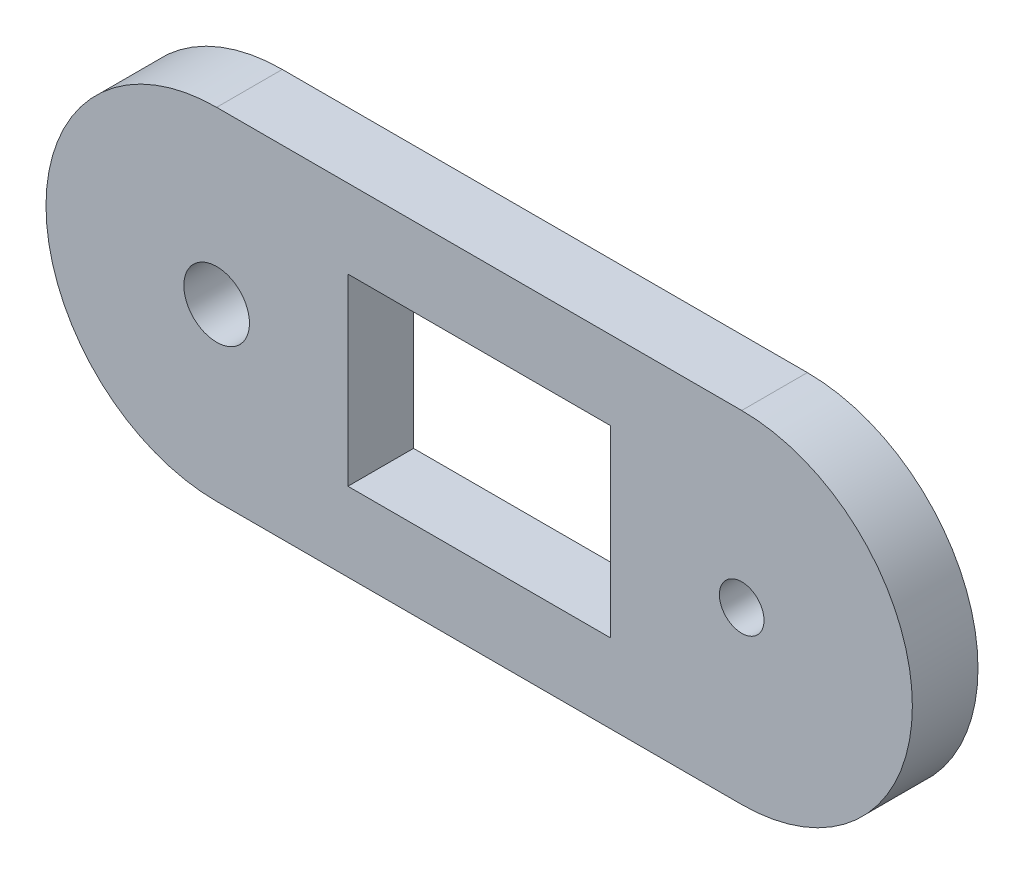
from build123d import *

# Parameters (mm, degrees)
SKETCH1_R           = 2.159
SKETCH1_R_2         = 3.175
SKETCH1_W           = 25.4
SKETCH1_H           = 17.78
BOSS_EXTRUDE1_DEPTH = 6.35
SKETCH2_R           = 7.759647624
SKETCH2_R_2         = 3.81
BOSS_EXTRUDE2_DEPTH = 1.27


with BuildPart() as part:
    # Sketch1 → Boss-Extrude1 (new body)
    with BuildSketch(Plane.XY):
        with BuildLine():
            Line((25.4, 16.51), (-25.4, 16.51))
            ThreePointArc((-25.4, 16.51), (-41.91, 0), (-25.4, -16.51))
            Line((-25.4, -16.51), (25.4, -16.51))
            ThreePointArc((25.4, -16.51), (41.91, 0), (25.4, 16.51))
        make_face()
        with Locations((25.4, 0)):
            Circle(SKETCH1_R, mode=Mode.SUBTRACT)
        with Locations((-25.4, 0)):
            Circle(SKETCH1_R_2, mode=Mode.SUBTRACT)
        Rectangle(SKETCH1_W, SKETCH1_H, mode=Mode.SUBTRACT)
    extrude(amount=BOSS_EXTRUDE1_DEPTH)

    # Sketch2 → Boss-Extrude2 (add)
    with BuildSketch(Plane.XY.offset(6.35)):
        with Locations((25.4, 0)):
            Circle(SKETCH2_R)
        with Locations((25.4, 0)):
            Circle(SKETCH2_R_2, mode=Mode.SUBTRACT)
    extrude(amount=-BOSS_EXTRUDE2_DEPTH)


solid = part.part
